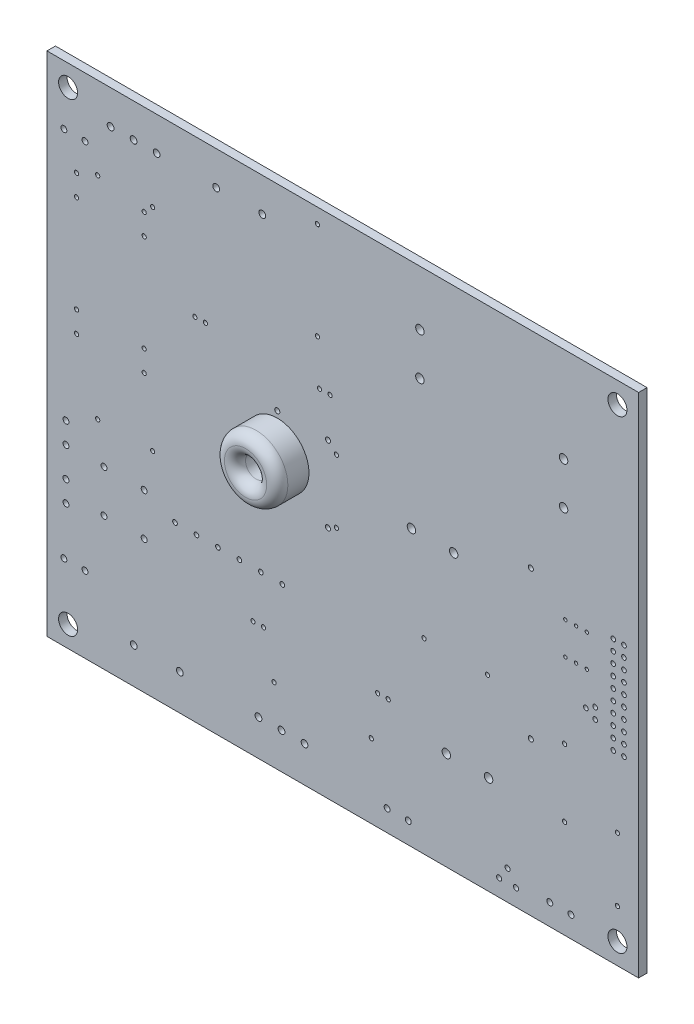
from build123d import *

# Parameters (mm, degrees)
SKETCH_1_W          = 140
SKETCH_1_H          = 120
SKETCH_1_R          = 2.25
EXTRUDE_1_DEPTH     = 2
SKETCH_2_R          = 0.55
SKETCH_2_R_2        = 0.5
SKETCH_2_R_3        = 0.8
CUT_EXTRUDE_1_DEPTH = 2
SKETCH_3_R          = 0.4
SKETCH_3_R_2        = 0.55
SKETCH_3_R_3        = 0.7
SKETCH_3_R_4        = 0.6
SKETCH_3_R_5        = 0.5
SKETCH_3_R_6        = 1
CUT_EXTRUDE_2_DEPTH = 10
SKETCH_4_R          = 0.6
SKETCH_4_R_2        = 0.7
SKETCH_4_R_3        = 0.5
CUT_EXTRUDE_3_DEPTH = 10
SKETCH_5_R          = 7.5
SKETCH_5_R_2        = 2.5
EXTRUDE_2_DEPTH     = 7.5
FILLET_1_R          = 2.5


with BuildPart() as part:
    # Эскиз1 → Вытянуть1 (new body)
    with BuildSketch(Plane.XY):
        Rectangle(SKETCH_1_W, SKETCH_1_H)
        with Locations((-65, -55)):
            Circle(SKETCH_1_R, mode=Mode.SUBTRACT)
        with Locations(Location((65, -55, 0), (0, 0, 180))):
            Circle(SKETCH_1_R, mode=Mode.SUBTRACT)
        with Locations((65, 55)):
            Circle(SKETCH_1_R, mode=Mode.SUBTRACT)
        with Locations(Location((-65, 55, 0), (0, 0, 180))):
            Circle(SKETCH_1_R, mode=Mode.SUBTRACT)
    extrude(amount=EXTRUDE_1_DEPTH)

    # Эскиз2 → Вырез-Вытянуть1 (cut)
    with BuildSketch(Plane.XY.offset(2)):
        with Locations((64, 6.5)):
            Circle(SKETCH_2_R)
        with Locations((66.54, 6.5)):
            Circle(SKETCH_2_R)
        with Locations((64, 3.96)):
            Circle(SKETCH_2_R)
        with Locations((66.54, 3.96)):
            Circle(SKETCH_2_R)
        with Locations((64, 1.42)):
            Circle(SKETCH_2_R)
        with Locations((66.54, 1.42)):
            Circle(SKETCH_2_R)
        with Locations((64, -1.12)):
            Circle(SKETCH_2_R)
        with Locations((66.54, -1.12)):
            Circle(SKETCH_2_R)
        with Locations((64, -3.66)):
            Circle(SKETCH_2_R)
        with Locations((66.54, -3.66)):
            Circle(SKETCH_2_R)
        with Locations((64, -6.2)):
            Circle(SKETCH_2_R)
        with Locations((66.54, -6.2)):
            Circle(SKETCH_2_R)
        with Locations((64, -8.74)):
            Circle(SKETCH_2_R)
        with Locations((66.54, -8.74)):
            Circle(SKETCH_2_R)
        with Locations((64, -11.28)):
            Circle(SKETCH_2_R)
        with Locations((66.54, -11.28)):
            Circle(SKETCH_2_R)
        with Locations((64, -13.82)):
            Circle(SKETCH_2_R)
        with Locations((66.54, -13.82)):
            Circle(SKETCH_2_R)
        with Locations((64, -16.36)):
            Circle(SKETCH_2_R)
        with Locations((66.54, -16.36)):
            Circle(SKETCH_2_R)
        with Locations((65, -47.75)):
            Circle(SKETCH_2_R_2)
        with Locations((65, -32.75)):
            Circle(SKETCH_2_R_2)
        with Locations((-54.95, 52)):
            Circle(SKETCH_2_R_3)
        with Locations((-49.5, 52)):
            Circle(SKETCH_2_R_3)
        with Locations((-44.05, 52)):
            Circle(SKETCH_2_R_3)
        with Locations((-29.95, 52)):
            Circle(SKETCH_2_R_3)
        with Locations((-34.62, -21.5)):
            Circle(SKETCH_2_R)
        with Locations((-19.05, 52)):
            Circle(SKETCH_2_R_3)
        with Locations((-49.45, -51.5)):
            Circle(SKETCH_2_R_3)
        with Locations((-29.54, -21.5)):
            Circle(SKETCH_2_R)
        with Locations((-38.55, -51.5)):
            Circle(SKETCH_2_R_3)
        with Locations((-19.95, -51.5)):
            Circle(SKETCH_2_R_3)
        with Locations((-14.5, -51.5)):
            Circle(SKETCH_2_R_3)
        with Locations((-9.05, -51.5)):
            Circle(SKETCH_2_R_3)
        with Locations((-24.46, -21.5)):
            Circle(SKETCH_2_R)
        with Locations((-19.38, -21.5)):
            Circle(SKETCH_2_R)
        with Locations((-14.3, -21.5)):
            Circle(SKETCH_2_R)
        with Locations((-39.7, -21.5)):
            Circle(SKETCH_2_R)
        with Locations((19.25, -15.75)):
            Circle(SKETCH_2_R_2)
        with Locations((34.25, -15.75)):
            Circle(SKETCH_2_R_2)
        with Locations((-1.5, -3.5)):
            Circle(SKETCH_2_R_2)
        with Locations((-1.5, 11.5)):
            Circle(SKETCH_2_R_2)
    extrude(amount=-CUT_EXTRUDE_1_DEPTH, mode=Mode.SUBTRACT)

    # Эскиз3 → Вырез-Вытянуть2 (cut)
    with BuildSketch(Plane.XY.offset(2)):
        with Locations((57.75, 4.75)):
            Circle(SKETCH_3_R)
        with Locations((57.75, -2.87)):
            Circle(SKETCH_3_R)
        with Locations((55.21, -2.87)):
            Circle(SKETCH_3_R)
        with Locations((55.21, 4.75)):
            Circle(SKETCH_3_R)
        with Locations((52.67, -2.87)):
            Circle(SKETCH_3_R)
        with Locations((52.67, 4.75)):
            Circle(SKETCH_3_R)
        with Locations((59.73, -9.605)):
            Circle(SKETCH_3_R_2)
        with Locations((59.73, -12.145)):
            Circle(SKETCH_3_R_2)
        with Locations((57.54, -10.875)):
            Circle(SKETCH_3_R_2)
        with Locations((49, -55)):
            Circle(SKETCH_3_R_3)
        with Locations((10.5, -55)):
            Circle(SKETCH_3_R_3)
        with Locations((54, -55)):
            Circle(SKETCH_3_R_3)
        with Locations((15.5, -55)):
            Circle(SKETCH_3_R_3)
        with Locations((-65.5, -18.5)):
            Circle(SKETCH_3_R_3)
        with Locations((-65.5, -13.5)):
            Circle(SKETCH_3_R_3)
        with Locations((-65.5, -30.5)):
            Circle(SKETCH_3_R_3)
        with Locations((-65.5, -25.5)):
            Circle(SKETCH_3_R_3)
        with Locations((37, -56)):
            Circle(SKETCH_3_R_4)
        with Locations((41, -56)):
            Circle(SKETCH_3_R_4)
        with Locations((39, -53)):
            Circle(SKETCH_3_R_4)
        with Locations((52.5, -36.75)):
            Circle(SKETCH_3_R_5)
        with Locations((52.5, -20.75)):
            Circle(SKETCH_3_R_5)
        with Locations((44.5, -23.75)):
            Circle(SKETCH_3_R_4)
        with Locations((44.5, 11.25)):
            Circle(SKETCH_3_R_4)
        with Locations((52.25, 27.5)):
            Circle(SKETCH_3_R_6)
        with Locations((52.25, 37.5)):
            Circle(SKETCH_3_R_6)
        with Locations((18.25, 37)):
            Circle(SKETCH_3_R_6)
        with Locations((18.25, 47)):
            Circle(SKETCH_3_R_6)
        with Locations((16.25, 5.25)):
            Circle(SKETCH_3_R_6)
        with Locations((26.25, 5.25)):
            Circle(SKETCH_3_R_6)
        with Locations((24.5, -36.75)):
            Circle(SKETCH_3_R_6)
        with Locations((34.5, -36.75)):
            Circle(SKETCH_3_R_6)
        with Locations((-66, 46)):
            Circle(SKETCH_3_R_3)
        with Locations((-61, 46)):
            Circle(SKETCH_3_R_3)
        with Locations((-66, -42)):
            Circle(SKETCH_3_R_3)
        with Locations((-61, -42)):
            Circle(SKETCH_3_R_3)
    extrude(amount=-CUT_EXTRUDE_2_DEPTH, mode=Mode.SUBTRACT)

    # Эскиз4 → Вырез-Вытянуть3 (cut)
    with BuildSketch(Plane.XY.offset(2)):
        with Locations((-15.5, -4.5)):
            Circle(SKETCH_4_R)
        with Locations((-15.5, 3)):
            Circle(SKETCH_4_R)
        with Locations((-15.5, 6)):
            Circle(SKETCH_4_R)
        with Locations((-15.5, 13.5)):
            Circle(SKETCH_4_R)
        with Locations((-3.5, 13.5)):
            Circle(SKETCH_4_R)
        with Locations((-3.5, -4.5)):
            Circle(SKETCH_4_R)
        with Locations((-56.5, -28.5)):
            Circle(SKETCH_4_R_2)
        with Locations((-56.5, -18.5)):
            Circle(SKETCH_4_R_2)
        with Locations((-6, 33.5)):
            Circle(SKETCH_4_R_3)
        with Locations((-6, 56.5)):
            Circle(SKETCH_4_R_3)
        with Locations((-47, -28.5)):
            Circle(SKETCH_4_R_2)
        with Locations((-47, -18.5)):
            Circle(SKETCH_4_R_2)
        with Locations((-63, 5.5)):
            Circle(SKETCH_4_R_3)
        with Locations((-63, 38.5)):
            Circle(SKETCH_4_R_3)
        with Locations((-63, 33.5)):
            Circle(SKETCH_4_R_3)
        with Locations((-63, 10.5)):
            Circle(SKETCH_4_R_3)
        with Locations((-47, 5.5)):
            Circle(SKETCH_4_R_3)
        with Locations((-47, 38.5)):
            Circle(SKETCH_4_R_3)
        with Locations((-47, 33.5)):
            Circle(SKETCH_4_R_3)
        with Locations((-47, 10.5)):
            Circle(SKETCH_4_R_3)
        with Locations((-58, -9.5)):
            Circle(SKETCH_4_R_3)
        with Locations((-45, -9.5)):
            Circle(SKETCH_4_R_3)
        with Locations((-58, 40.5)):
            Circle(SKETCH_4_R_3)
        with Locations((-45, 40.5)):
            Circle(SKETCH_4_R_3)
        with Locations((-35, 23)):
            Circle(SKETCH_4_R_3)
        with Locations((-3, 23)):
            Circle(SKETCH_4_R_3)
        with Locations((-32.5, 23)):
            Circle(SKETCH_4_R_3)
        with Locations((-5.5, 23)):
            Circle(SKETCH_4_R_3)
        with Locations((-16.25, -42.5)):
            Circle(SKETCH_4_R_3)
        with Locations((6.75, -42.5)):
            Circle(SKETCH_4_R_3)
        with Locations((-21.25, -32.5)):
            Circle(SKETCH_4_R_3)
        with Locations((10.75, -32.5)):
            Circle(SKETCH_4_R_3)
        with Locations((-18.75, -32.5)):
            Circle(SKETCH_4_R_3)
        with Locations((8.25, -32.5)):
            Circle(SKETCH_4_R_3)
    extrude(amount=-CUT_EXTRUDE_3_DEPTH, mode=Mode.SUBTRACT)

    # Эскиз5 → Вытянуть2 (add)
    with BuildSketch(Plane.XY.offset(2)):
        with Locations(Location((-15.5, 4.5, 0), (0, 0, 180))):
            Circle(SKETCH_5_R)
        with Locations((-15.5, 4.5)):
            Circle(SKETCH_5_R_2, mode=Mode.SUBTRACT)
    extrude(amount=EXTRUDE_2_DEPTH)

    # Скругление1
    fillet_1_edges = [part.edges().sort_by_distance(p)[0] for p in [
        (-8, 4.5, 9.5),
        (-18, 4.5, 9.5),
    ]]
    fillet(fillet_1_edges, radius=FILLET_1_R - 0.0001)  # a hair under: the kernel refuses the full size


solid = part.part
